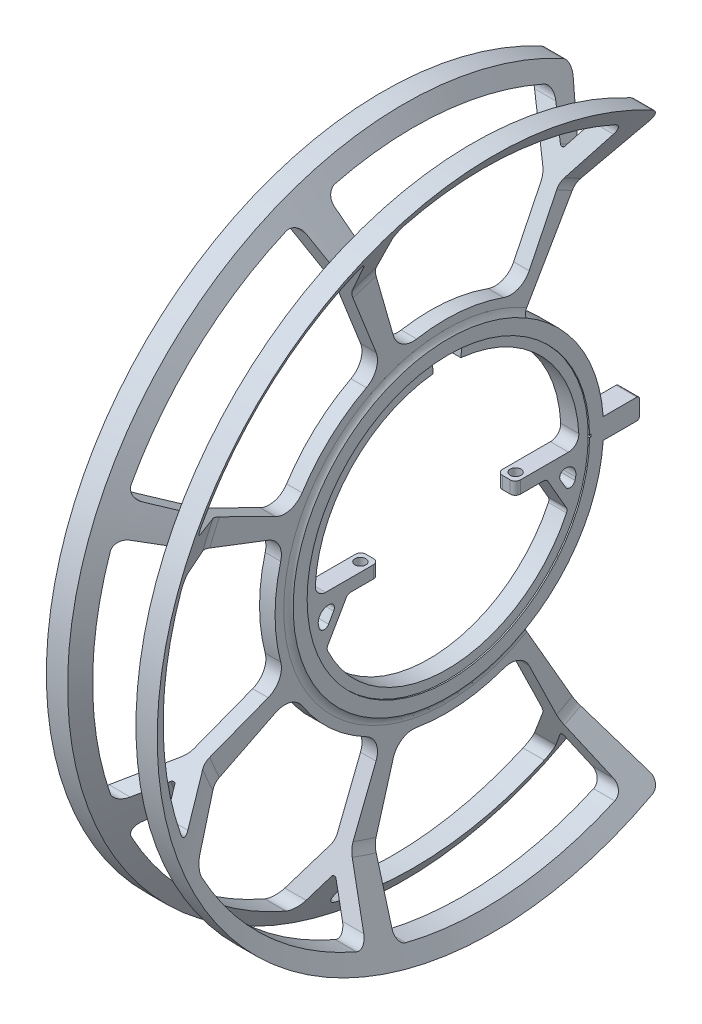
from build123d import *

# Parameters (mm, degrees)
REVOLVE2_ANGLE                          = 174
BOSS_EXTRUDE1_START                     = -1.75
BOSS_EXTRUDE1_DEPTH                     = 3.5
FILLET1_R                               = 2
FILLET2_R                               = 1
CUT_EXTRUDE1_REACH                      = 44.474
SKETCH4_R                               = 1.05
SKETCH5_W                               = 7
SKETCH5_H                               = 4
BOSS_EXTRUDE2_DEPTH                     = 2
CUT_REVOLVE1_ANGLE                      = 1
FILLET3_R                               = 0.5
FILLET5_R                               = 1
SKETCH8_W                               = 3
SKETCH8_H                               = 20
REVOLVE3_ANGLE                          = 240
SKETCH8_4_W                             = 3
SKETCH8_4_H                             = 20
REVOLVE4_ANGLE                          = 5
FILLET8_ANGLE                           = 240
FILLET9_R                               = 2
FILLET11_R                              = 0.5
FILLET12_R                              = 4
CUT_EXTRUDE3_DEPTH                      = 93.546155128
FILLET10_R                              = 2
FILLET13_R                              = 4
CIRPATTERN4_COUNT                       = 3
CIRPATTERN4_ANGLE                       = 95
FILLET10_OF_CIRPATTERN4_R               = 2
FILLET13_OF_CIRPATTERN4_R               = 4
CIRPATTERN4_THE_OTHER_WAY_COUNT         = 3
CIRPATTERN4_THE_OTHER_WAY_ANGLE         = 95
FILLET10_OF_CIRPATTERN4_THE_OTHER_WAY_R = 2
FILLET13_OF_CIRPATTERN4_THE_OTHER_WAY_R = 4


with BuildPart() as part:
    # Sketch2 → Revolve1 (revolve)
    with BuildSketch(Plane(origin=(0, 0, 0), x_dir=(1, 0, 0), z_dir=(0, 1, 0)), mode=Mode.PRIVATE) as revolve1_sk:
        Polygon((-0.5, 28.5), (0, 28.5), (0, 30), (-2, 30), (-2, 27.3), (-1.506919557, 27.3), align=None)
    revolve1 = revolve(revolve1_sk.sketch.rotate(Axis((0, 0, 0), (1, 0, 0)), 180), axis=Axis((0, 0, 0), (1, 0, 0)))


with BuildPart() as body_2:
    # Revolve2: read off the stored shape, not the designer's step
    # Revolve2 outline → Revolve2 (revolve)
    with BuildSketch(Plane(origin=(0, 0, 0), x_dir=(0, -1, 0), z_dir=(0, 0, 1))):
        Polygon((25.5, 0), (25.5, -1.75), (27.29, -1.75), (27.29, -1.502256481), (28.491219063, -0.494314008), (28.491219063, 0), align=None)
    revolve2 = revolve(axis=Axis((0, 0, 0), (1, 0, 0)), revolution_arc=REVOLVE2_ANGLE)


with BuildPart() as part_1:
    add(part.part)

    add(body_2.part)  # Mirror1 merges body 2
    # Mirror1: Revolve1, Revolve2 across plane
    add(revolve1.mirror(Plane(origin=(0, 0, 0), x_dir=(0, 0, 1), z_dir=(1, 0, 0))))
    add(revolve2.mirror(Plane(origin=(0, 0, 0), x_dir=(0, 0, 1), z_dir=(1, 0, 0))))

    # Sketch3 → Boss-Extrude1 (add)
    with BuildSketch(Plane(origin=(0, 0, 0), x_dir=(0, 0, -1), z_dir=(1, 0, 0)).offset(BOSS_EXTRUDE1_START)):
        with BuildLine():
            ThreePointArc((25.292044204, -3.25), (25.417279788, -2.052288521), (25.485829396, -0.85))
            Line((25.485829396, -0.85), (13.2, -0.85))
            Line((13.2, -0.85), (13.2, -3.25))
            Line((13.2, -3.25), (19.2, -3.25))
            Line((19.2, -3.25), (23.302526372, -10.355784116))
            ThreePointArc((23.302526372, -10.355784116), (23.69804938, -9.415543296), (24.055652184, -8.460236286))
            Line((24.055652184, -8.460236286), (21.047520861, -3.25))
            Line((21.047520861, -3.25), (25.292044204, -3.25))
        make_face()
    extrude(amount=BOSS_EXTRUDE1_DEPTH)

    # Fillet1
    fillet1_edges = [part_1.edges().sort_by_distance(p)[0] for p in [
        (0, -0.85, -25.485829396),
        (0, -3.25, -25.292044204),
    ]]
    fillet(fillet1_edges, radius=FILLET1_R)

    # Fillet2
    fillet2_edges = [part_1.edges().sort_by_distance(p)[0] for p in [
        (0, -3.25, -21.047520861),
        (0, -8.460236286, -24.055652184),
        (0, -10.355784116, -23.302526372),
        (0, -3.25, -19.2),
    ]]
    fillet(fillet2_edges, radius=FILLET2_R)

    # Sketch4 → Cut-Extrude1 (cut, up to next)
    with BuildSketch(Plane(origin=(0, 0, 0), x_dir=(1, 0, 0), z_dir=(0, 1, 0)), mode=Mode.PRIVATE) as cut_extrude1_sk1:
        with Locations(Location((0, 15, 0), (0, 0, 270))):
            Circle(SKETCH4_R)
    cut_extrude1_tool1 = extrude(cut_extrude1_sk1.sketch, amount=-CUT_EXTRUDE1_REACH, mode=Mode.PRIVATE) & part_1.part
    add(cut_extrude1_tool1.solids().sort_by_distance((0, 0, -15))[0], mode=Mode.SUBTRACT)

    # Mirror2: part across plane


with BuildPart() as part_2:
    add(part_1.part)
    add(part_1.part.mirror(Plane.XY))

    # Sketch5 → Boss-Extrude2 (add, symmetric)
    with BuildSketch(Plane(origin=(0, 0, 0), x_dir=(0, 0, -1), z_dir=(1, 0, 0))):
        with Locations((33.433259094, 0)):
            Rectangle(SKETCH5_W, SKETCH5_H)
    extrude(amount=BOSS_EXTRUDE2_DEPTH, both=True)

    # Sketch6 → Cut-Revolve1 (revolve, symmetric, cut)
    with BuildSketch(Plane(origin=(0, 0, 0), x_dir=(1, 0, 0), z_dir=(0, 1, 0))) as cut_revolve1_sk:
        Polygon((-2, 27.6), (-2, 27.3), (-1.506919557, 27.3), (-0.5, 28.5), (0, 28.5), (0, 28.8), (-0.639892297, 28.8), (-1.646811855, 27.6), align=None)
    cut_revolve1 = revolve(axis=Axis((0, 0, 0), (1, 0, 0)), revolution_arc=CUT_REVOLVE1_ANGLE / 2, mode=Mode.SUBTRACT)
    cut_revolve1 = cut_revolve1 + revolve(cut_revolve1_sk.sketch, axis=Axis((0, 0, 0), (-1, 0, 0)), revolution_arc=CUT_REVOLVE1_ANGLE / 2, mode=Mode.SUBTRACT)

    # Mirror3: Cut-Revolve1 across plane
    add(cut_revolve1.mirror(Plane(origin=(0, 0, 0), x_dir=(0, 0, 1), z_dir=(1, 0, 0))), mode=Mode.SUBTRACT)

    # Fillet3
    fillet3_edges = [part_2.edges().sort_by_distance(p)[0] for p in [
        (0, 2, -36.933259094),
        (0, -2, -36.933259094),
    ]]
    fillet(fillet3_edges, radius=FILLET3_R)

    # Fillet5
    fillet5_edges = [part_2.edges().sort_by_distance(p)[0] for p in [
        (1.75, -2.05, 13.2),
        (-1.75, -2.05, 13.2),
        (1.75, -2.05, -13.2),
        (-1.75, -2.05, -13.2),
    ]]
    fillet(fillet5_edges, radius=FILLET5_R)



with BuildPart() as body_2_2:
    # Sketch8 → Revolve3 (revolve, symmetric)
    with BuildSketch(Plane.XZ) as revolve3_sk:
        Polygon((-1.5, 50), (1.5, 50), (10.714046894, 65), (6.606461182, 65), (0, 54.245016998), (-6.606461182, 65), (-10.714046894, 65), align=None)
        with Locations((0, 40)):
            Rectangle(SKETCH8_W, SKETCH8_H)
    revolve(axis=Axis((0, 0, 0), (1, 0, 0)), revolution_arc=REVOLVE3_ANGLE / 2)
    revolve(revolve3_sk.sketch, axis=Axis((0, 0, 0), (-1, 0, 0)), revolution_arc=REVOLVE3_ANGLE / 2)


with BuildPart() as part_3:
    add(part_2.part)

    add(body_2_2.part)  # Revolve4 merges body 2 2
    # Sketch8<4> → Revolve4 (revolve, symmetric)
    with BuildSketch(Plane.XZ) as revolve4_sk:
        with Locations((0, 40)):
            Rectangle(SKETCH8_4_W, SKETCH8_4_H)
    revolve(axis=Axis((0, 0, 0), (1, 0, 0)), revolution_arc=REVOLVE4_ANGLE / 2)
    revolve(revolve4_sk.sketch, axis=Axis((0, 0, 0), (-1, 0, 0)), revolution_arc=REVOLVE4_ANGLE / 2)

    # Fillet8: read off the stored shape, not the designer's step
    # Fillet8 outline → Fillet8 (revolve)
    with BuildSketch(Plane(origin=(0, 0, 0), x_dir=(0, 0.8660254037844354, -0.5000000000000057), z_dir=(0, -0.5000000000000057, -0.8660254037844354))):
        with BuildLine():
            ThreePointArc((30, -2), (30.615768875, -1.629171307), (31.322875656, -1.5))
            Line((31.322875656, -1.5), (30, -1.5))
            Line((30, -1.5), (30, -2))
        make_face()
        with BuildLine():
            Line((30, 1.5), (31.322875656, 1.5))
            ThreePointArc((31.322875656, 1.5), (30.615768875, 1.629171307), (30, 2))
            Line((30, 2), (30, 1.5))
        make_face()
    revolve(axis=Axis((0, 0, 0), (1, 0, 0)), revolution_arc=FILLET8_ANGLE)

    # Fillet9
    fillet9_edges = [part_3.edges().sort_by_distance(p)[0] for p in [
        (-8.660254038, 56.291651246, -32.5),
        (8.660254038, 56.291651246, -32.5),
        (8.660254038, -56.291651246, -32.5),
        (-8.660254038, -56.291651246, -32.5),
    ]]
    fillet(fillet9_edges, radius=FILLET9_R)

    # Fillet11
    fillet11_edges = [part_3.edges().sort_by_distance(p)[0] for p in [
        (0, 0, 54.245016998),
    ]]
    fillet(fillet11_edges, radius=FILLET11_R)

    # Fillet12
    fillet12_edges = [part_3.edges().sort_by_distance(p)[0] for p in [
        (-1.5, 0, 50),
        (1.5, 0, 50),
    ]]
    fillet(fillet12_edges, radius=FILLET12_R)

    # Sketch9 → Cut-Extrude3 (cut, symmetric)
    with BuildSketch(Plane(origin=(0, 0, 0), x_dir=(0, 0, -1), z_dir=(1, 0, 0))):
        with BuildLine():
            Line((-30.808154074, -11.826142335), (-57.881986443, -22.218812872))
            ThreePointArc((-57.881986443, -22.218812872), (-62, 0), (-57.881986443, 22.218812872))
            Line((-57.881986443, 22.218812872), (-30.808154074, 11.826142335))
            ThreePointArc((-30.808154074, 11.826142335), (-33, 0), (-30.808154074, -11.826142335))
        make_face()
    cut_extrude3 = extrude(amount=CUT_EXTRUDE3_DEPTH, both=True, mode=Mode.SUBTRACT)

    # Fillet10
    fillet10_edges = [part_3.edges().sort_by_distance(p)[0] for p in [
        (6.817444659, -22.218812872, 57.881986443),
        (-6.817444659, -22.218812872, 57.881986443),
        (-6.817444659, 22.218812872, 57.881986443),
        (6.817444659, 22.218812872, 57.881986443),
    ]]
    fillet(fillet10_edges, radius=FILLET10_R)

    # Fillet13
    fillet13_edges = [part_3.edges().sort_by_distance(p)[0] for p in [
        (0, 11.826142335, 30.808154074),
        (0, -11.826142335, 30.808154074),
    ]]
    fillet(fillet13_edges, radius=FILLET13_R)

    # CirPattern4: Cut-Extrude3 ×3 about axis
    cirpattern4_axis = Axis((0, 0, 0), (1, 0, 0))
    for i in range(1, CIRPATTERN4_COUNT):
        add(cut_extrude3.rotate(cirpattern4_axis, i * CIRPATTERN4_ANGLE / (CIRPATTERN4_COUNT - 1)), mode=Mode.SUBTRACT)

    # Fillet10 of CirPattern4
    fillet10_of_cirpattern4_edges = [part_3.edges().sort_by_distance(p)[0] for p in [
        (6.817444659, -57.685889215, 22.723076057),
        (-6.817444659, -57.685889215, 22.723076057),
        (-6.817444659, -27.664264413, 55.485930419),
        (6.817444659, -27.664264413, 55.485930419),
        (6.817444659, -55.725230871, -27.179011101),
        (-6.817444659, -55.725230871, -27.179011101),
        (-6.817444659, -59.598225148, 17.089516061),
        (6.817444659, -59.598225148, 17.089516061),
    ]]
    fillet(fillet10_of_cirpattern4_edges, radius=FILLET10_OF_CIRPATTERN4_R)

    # Fillet13 of CirPattern4
    fillet13_of_cirpattern4_edges = [part_3.edges().sort_by_distance(p)[0] for p in [
        (0, -14.724527833, 29.532833933),
        (0, -30.703779743, 12.094540482),
        (0, -31.721635966, 9.096032742),
        (0, -29.660203528, -14.466247844),
    ]]
    fillet(fillet13_of_cirpattern4_edges, radius=FILLET13_OF_CIRPATTERN4_R)

    # CirPattern4 the other way: Cut-Extrude3 ×3 about axis
    cirpattern4_the_other_way_axis = Axis((0, 0, 0), (-1, 0, 0))
    for i in range(1, CIRPATTERN4_THE_OTHER_WAY_COUNT):
        add(cut_extrude3.rotate(cirpattern4_the_other_way_axis, i * CIRPATTERN4_THE_OTHER_WAY_ANGLE / (CIRPATTERN4_THE_OTHER_WAY_COUNT - 1)), mode=Mode.SUBTRACT)

    # Fillet10 of CirPattern4 the other way
    fillet10_of_cirpattern4_the_other_way_edges = [part_3.edges().sort_by_distance(p)[0] for p in [
        (6.817444659, 27.664264413, 55.485930419),
        (-6.817444659, 27.664264413, 55.485930419),
        (-6.817444659, 57.685889215, 22.723076057),
        (6.817444659, 57.685889215, 22.723076057),
        (6.817444659, 59.598225148, 17.089516061),
        (-6.817444659, 59.598225148, 17.089516061),
        (-6.817444659, 55.725230871, -27.179011101),
        (6.817444659, 55.725230871, -27.179011101),
    ]]
    fillet(fillet10_of_cirpattern4_the_other_way_edges, radius=FILLET10_OF_CIRPATTERN4_THE_OTHER_WAY_R)

    # Fillet13 of CirPattern4 the other way
    fillet13_of_cirpattern4_the_other_way_edges = [part_3.edges().sort_by_distance(p)[0] for p in [
        (0, 30.703779743, 12.094540482),
        (0, 14.724527833, 29.532833933),
        (0, 29.660203528, -14.466247844),
        (0, 31.721635966, 9.096032742),
    ]]
    fillet(fillet13_of_cirpattern4_the_other_way_edges, radius=FILLET13_OF_CIRPATTERN4_THE_OTHER_WAY_R)


solid = part_3.part
